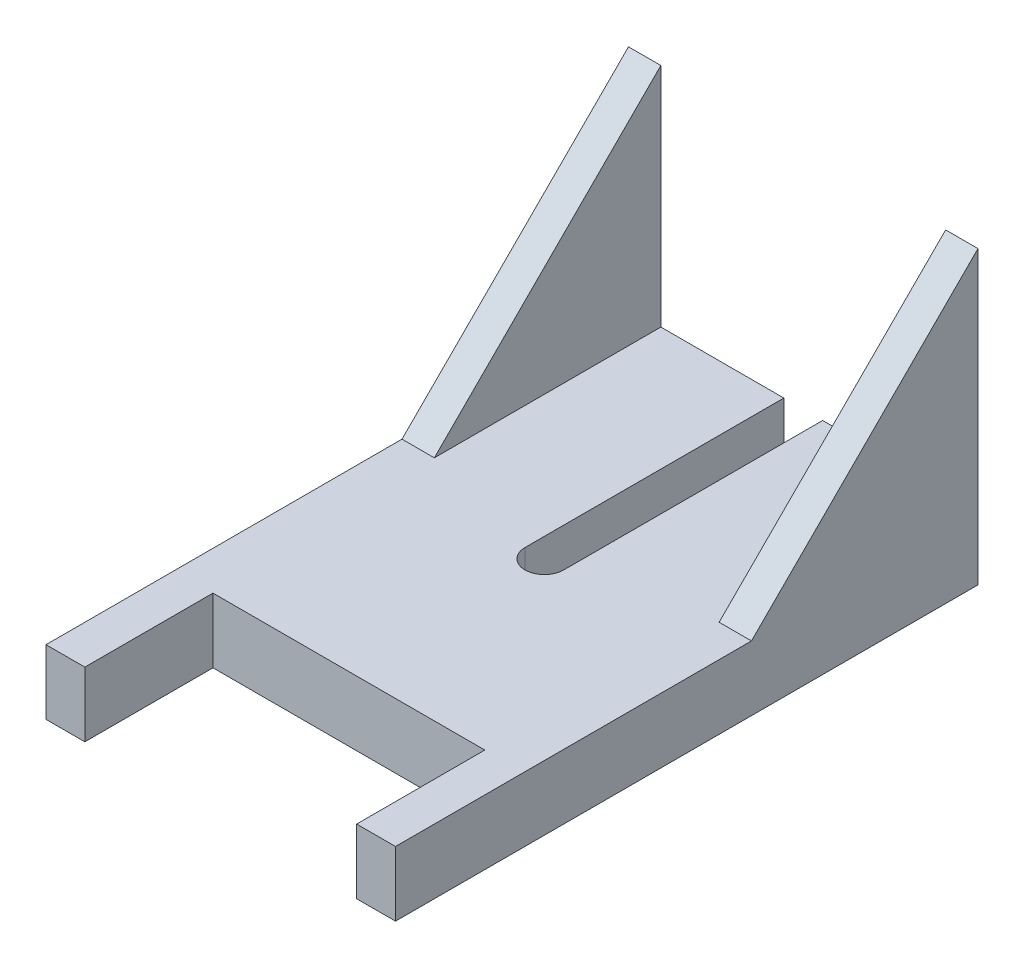
from build123d import *

# Parameters (mm, degrees)
SKETCH1_W           = 54
SKETCH1_H           = 10
BOSS_EXTRUDE1_DEPTH = 90
SKETCH2_W           = 42
SKETCH2_H           = 19.8
CUT_EXTRUDE1_DEPTH  = 99.192875432
CUT_EXTRUDE2_DEPTH  = 99.192875432
BOSS_EXTRUDE4_DEPTH = 5
BOSS_EXTRUDE5_DEPTH = 5


with BuildPart() as part:
    # Sketch1 → Boss-Extrude1 (new body)
    with BuildSketch(Plane.XY):
        with Locations((10.971578656, 527.175634265)):
            Rectangle(SKETCH1_W, SKETCH1_H)
    extrude(amount=BOSS_EXTRUDE1_DEPTH)

    # Sketch2 → Cut-Extrude1 (cut, through all)
    with BuildSketch(Plane.XZ.offset(-522.175634265)):
        with Locations((10.971578656, 80.1)):
            Rectangle(SKETCH2_W, SKETCH2_H)
    extrude(amount=-CUT_EXTRUDE1_DEPTH, mode=Mode.SUBTRACT)

    # Sketch4 → Cut-Extrude2 (cut, through all)
    with BuildSketch(Plane(origin=(0, 532.175634265, 0), x_dir=(1, 0, 0), z_dir=(0, 1, 0))):
        with BuildLine():
            Line((7.971578656, -40), (7.971578656, 0))
            ThreePointArc((7.971578656, 0), (10.971578656, 3), (13.971578656, 0))
            Line((13.971578656, 0), (13.971578656, -40))
            ThreePointArc((13.971578656, -40), (10.971578656, -43), (7.971578656, -40))
        make_face()
    extrude(amount=-CUT_EXTRUDE2_DEPTH, mode=Mode.SUBTRACT)

    # Sketch7 → Boss-Extrude4 (add)
    with BuildSketch(Plane.ZY.offset(16.028421344)):
        Polygon((35, 532.175634265), (0, 567.175634265), (0, 532.175634265), align=None)
    extrude(amount=-BOSS_EXTRUDE4_DEPTH)

    # Sketch8 → Boss-Extrude5 (add)
    with BuildSketch(Plane(origin=(37.971578656, 0, 0), x_dir=(0, 0, -1), z_dir=(1, 0, 0))):
        Polygon((-35, 532.175634265), (0, 567.175634265), (0, 532.175634265), align=None)
    extrude(amount=-BOSS_EXTRUDE5_DEPTH)


solid = part.part
